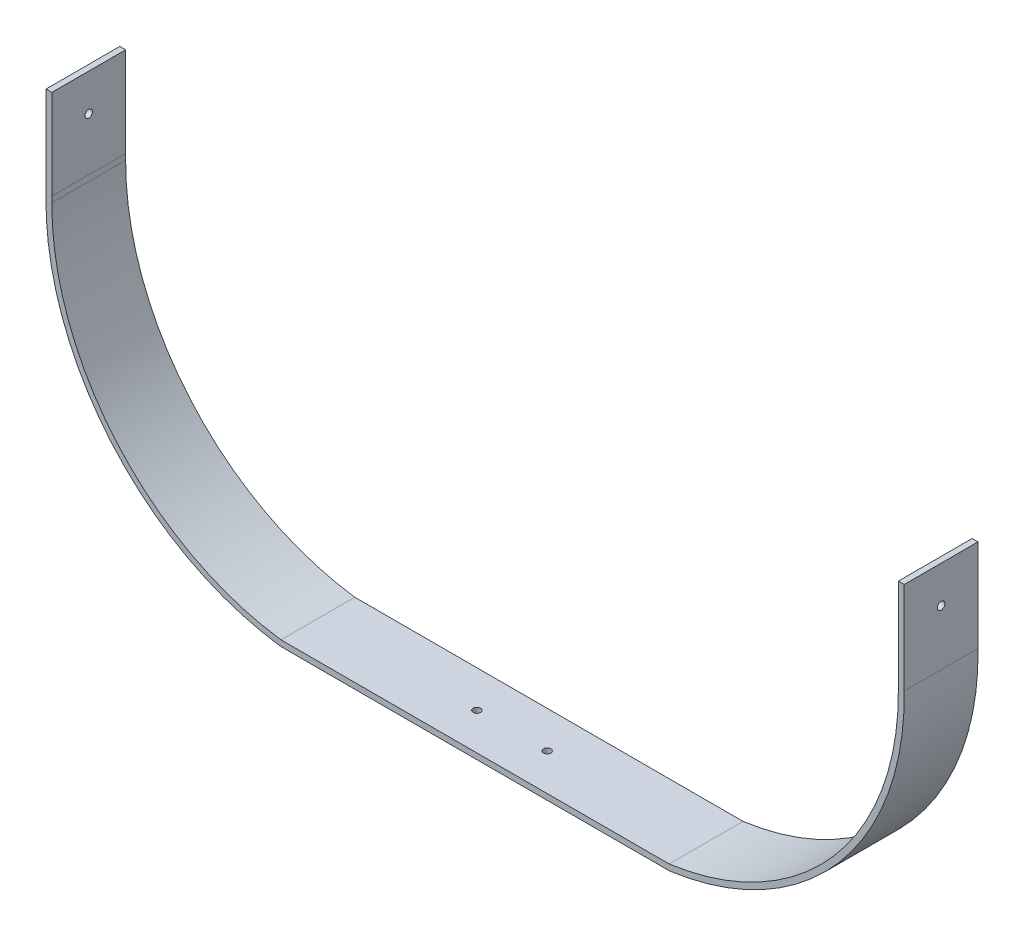
from build123d import *

# Parameters (mm, degrees)
BOSS_EXTRUDE1_DEPTH     = 40
SKETCH3_R               = 2
CUT_EXTRUDE1_DEPTH      = 309.010816155
CUT_EXTRUDE2_DEPTH      = 508.000813841
CUT_EXTRUDE2_DEPTH_BACK = 508.000813841
SKETCH4_R               = 2.047875


with BuildPart() as part:
    # Sketch1 → Boss-Extrude1 (new body)
    with BuildSketch(Plane.XY):
        with BuildLine():
            Line((-80, 0), (80, 0))
            Line((80, 0), (105.4, 0))
            ThreePointArc((105.4, 0), (197.101616124, 49.823848586), (232.5, 148))
            Line((232.5, 148), (232.5, 198))
            Line((232.5, 198), (229.325, 198))
            Line((229.325, 198), (229.325, 149.343064798))
            Line((229.325, 149.343064798), (229.325, 146.163102833))
            ThreePointArc((229.325, 146.163102833), (194.166712676, 51.306506634), (105.185150713, 3.18))
            Line((105.185150713, 3.18), (80, 3.18))
            Line((80, 3.18), (-80, 3.18))
            Line((-80, 3.18), (-105.185150713, 3.18))
            ThreePointArc((-105.185150713, 3.18), (-194.17641713, 51.301905299), (-229.340553269, 146.163102833))
            Line((-229.340553269, 146.163102833), (-229.325, 149.343064798))
            Line((-229.325, 149.343064798), (-229.325, 198))
            Line((-229.325, 198), (-232.5, 198))
            Line((-232.5, 198), (-232.5, 148))
            ThreePointArc((-232.5, 148), (-197.101616124, 49.823848586), (-105.4, 0))
            Line((-105.4, 0), (-80, 0))
        make_face()
    extrude(amount=BOSS_EXTRUDE1_DEPTH)

    # Sketch3 → Cut-Extrude1 (cut, through all)
    with BuildSketch(Plane(origin=(0, 0, 0), x_dir=(1, 0, 0), z_dir=(0, 1, 0))):
        with Locations((-19.05, -20)):
            Circle(SKETCH3_R)
        with Locations((19.05, -20)):
            Circle(SKETCH3_R)
    extrude(amount=CUT_EXTRUDE1_DEPTH, mode=Mode.SUBTRACT)

    # Sketch4 → Cut-Extrude2 (cut, two sides: drawn at the far end of the back side and taken through both)
    with BuildSketch(Plane.ZY.offset(232.5).offset(-CUT_EXTRUDE2_DEPTH_BACK)):
        with Locations((20, 178)):
            Circle(SKETCH4_R)
    extrude(amount=CUT_EXTRUDE2_DEPTH + CUT_EXTRUDE2_DEPTH_BACK, mode=Mode.SUBTRACT)


solid = part.part
